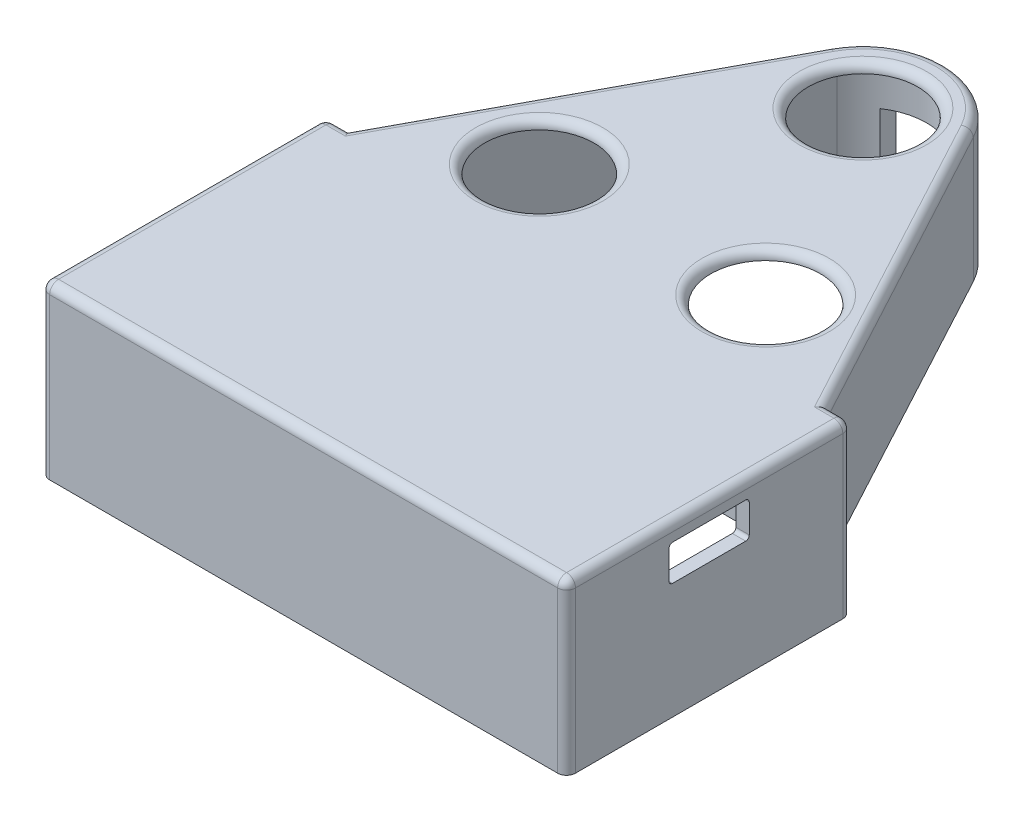
from build123d import *

# Parameters (mm, degrees)
SKETCH1_R           = 6.14
BOSS_EXTRUDE1_DEPTH = 1
BOSS_EXTRUDE2_START = -18
SKETCH1_7_R         = 6.14
SKETCH1_7_W         = 59
SKETCH1_7_H         = 32
SKETCH1_7_W_2       = 56
SKETCH1_7_H_2       = 29
BOSS_EXTRUDE2_DEPTH = 18
BOSS_EXTRUDE4_DEPTH = 14
FILLET1_R           = 1
CUT_EXTRUDE2_DEPTH  = 14
CUT_EXTRUDE3_DEPTH  = 14
FILLET2_R           = 1
SKETCH24_W          = 56
SKETCH24_H          = 1.5
CUT_EXTRUDE5_DEPTH  = 4
BOSS_EXTRUDE5_REACH = 54.785
SKETCH26_W          = 2
SKETCH26_H          = 1.85
BOSS_EXTRUDE6_REACH = 72.258
SKETCH27_W          = 2
SKETCH27_H          = 1.85
SKETCH29_W          = 8
SKETCH29_H          = 5
CUT_EXTRUDE7_DEPTH  = 10
CHAMFER1_SIZE       = 0.5
CHAMFER2_SIZE       = 0.25


# Some blends are built 0.0001 mm under size
with BuildPart() as part:
    # Sketch1 → Boss-Extrude1 (new body)
    with BuildSketch(Plane(origin=(0, 0, 0), x_dir=(1, 0, 0), z_dir=(0, 1, 0))):
        with BuildLine():
            Line((26.916456077, -7.14), (8.050130866, 27.948393818))
            ThreePointArc((8.050130866, 27.948393818), (0, 32.76), (-8.050130866, 27.948393818))
            Line((-8.050130866, 27.948393818), (-26.916456077, -7.14))
            Line((-26.916456077, -7.14), (-29.5, -7.14))
            Line((-29.5, -7.14), (-29.5, -39.14))
            Line((-29.5, -39.14), (29.5, -39.14))
            Line((29.5, -39.14), (29.5, -7.14))
            Line((29.5, -7.14), (26.916456077, -7.14))
        make_face()
        with Locations(Location((-12.7, 0, 0), (0, 0, 270))):
            Circle(SKETCH1_R, mode=Mode.SUBTRACT)
        with Locations(Location((0, 23.62, 0), (0, 0, 270))):
            Circle(SKETCH1_R, mode=Mode.SUBTRACT)
        with Locations(Location((12.7, 0, 0), (0, 0, 270))):
            Circle(SKETCH1_R, mode=Mode.SUBTRACT)
    extrude(amount=BOSS_EXTRUDE1_DEPTH)

    # Sketch1<7> → Boss-Extrude2 (add)
    # profile 1 of 4: a face of its own
    with BuildSketch(Plane(origin=(0, 0, 0), x_dir=(1, 0, 0), z_dir=(0, 1, 0)).offset(BOSS_EXTRUDE2_START)):
        with Locations(Location((-12.7, 0, 0), (0, 0, 270))):
            Circle(SKETCH1_7_R)
    # profile 2 of 4: a face of its own
    with BuildSketch(Plane(origin=(0, 0, 0), x_dir=(1, 0, 0), z_dir=(0, 1, 0)).offset(BOSS_EXTRUDE2_START)):
        with Locations(Location((0, 23.62, 0), (0, 0, 270))):
            Circle(SKETCH1_7_R)
    # profile 3 of 4: a face of its own
    with BuildSketch(Plane(origin=(0, 0, 0), x_dir=(1, 0, 0), z_dir=(0, 1, 0)).offset(BOSS_EXTRUDE2_START)):
        with Locations(Location((12.7, 0, 0), (0, 0, 270))):
            Circle(SKETCH1_7_R)
    # profile 4 of 4: a face of its own
    with BuildSketch(Plane(origin=(0, 0, 0), x_dir=(1, 0, 0), z_dir=(0, 1, 0)).offset(BOSS_EXTRUDE2_START)):
        with Locations((0, -23.14)):
            Rectangle(SKETCH1_7_W, SKETCH1_7_H)
        with Locations((0, -23.14)):
            Rectangle(SKETCH1_7_W_2, SKETCH1_7_H_2, mode=Mode.SUBTRACT)
    extrude(amount=BOSS_EXTRUDE2_DEPTH)


with BuildPart() as boss_extrude2_kept_piece:
    # of the separate pieces the step leaves, the one the design keeps (boss_extrude2_pieces_kept)
    add(part.part.solids().sort_by_distance((26.916456077, 0, 7.14))[0])

    # Sketch16 → Boss-Extrude4 (add)
    with BuildSketch(Plane.XZ):
        with BuildLine():
            Line((-24.645685539, 7.14), (-6.288614265, -27.001261692))
            ThreePointArc((-6.288614265, -27.001261692), (0, -30.76), (6.288614265, -27.001261692))
            Line((6.288614265, -27.001261692), (24.645685539, 7.14))
            Line((24.645685539, 7.14), (26.916456077, 7.14))
            Line((26.916456077, 7.14), (8.050130866, -27.948393818))
            ThreePointArc((8.050130866, -27.948393818), (0, -32.76), (-8.050130866, -27.948393818))
            Line((-8.050130866, -27.948393818), (-26.916456077, 7.14))
            Line((-26.916456077, 7.14), (-24.645685539, 7.14))
        make_face()
    extrude(amount=BOSS_EXTRUDE4_DEPTH)

    # Fillet1
    fillet1_edges = [boss_extrude2_kept_piece.edges().sort_by_distance(p)[0] for p in [
        (-29.5, -8.5, 7.14),
        (29.5, -8.5, 7.14),
        (29.5, -8.5, 39.14),
        (-29.5, -8.5, 39.14),
    ]]
    fillet(fillet1_edges, radius=FILLET1_R)

    # Sketch19 → Cut-Extrude2 (cut)
    with BuildSketch(Plane(origin=(29.5, 0, 0), x_dir=(0, 0, -1), z_dir=(1, 0, 0))):
        with BuildLine():
            Line((-27.24, -1), (-19.04, -1))
            ThreePointArc((-19.04, -1), (-18.757157288, -1.117157288), (-18.64, -1.4))
            Line((-18.64, -1.4), (-18.64, -4.6))
            ThreePointArc((-18.64, -4.6), (-18.757157288, -4.882842712), (-19.04, -5))
            Line((-19.04, -5), (-27.24, -5))
            ThreePointArc((-27.24, -5), (-27.522842712, -4.882842712), (-27.64, -4.6))
            Line((-27.64, -4.6), (-27.64, -1.4))
            ThreePointArc((-27.64, -1.4), (-27.522842712, -1.117157288), (-27.24, -1))
        make_face()
    extrude(amount=-CUT_EXTRUDE2_DEPTH, mode=Mode.SUBTRACT)

    # Sketch21 → Cut-Extrude3 (cut)
    with BuildSketch(Plane.XY.offset(8.64)):
        Polygon((8, 0), (-8, 0), (-8, -5.911265283), (-8, -14), (8, -14), (8, -5.911265283), align=None)
    extrude(amount=-CUT_EXTRUDE3_DEPTH, mode=Mode.SUBTRACT)

    # Fillet2
    fillet2_edges = [boss_extrude2_kept_piece.edges().sort_by_distance(p)[0] for p in [
        (0, 1, 39.14),
        (-29.5, 1, 23.14),
        (29.5, 1, 23.14),
        (-27.708228038, 1, 7.14),
        (29.207106781, 1, 7.432893219),
        (29.207106781, 1, 38.847106781),
        (-29.207106781, 1, 7.432893219),
        (-29.207106781, 1, 38.847106781),
        (27.708228038, 1, 7.14),
        (17.483293471, 1, -10.404196909),
        (0, 1, -32.76),
        (-17.483293471, 1, -10.404196909),
        (-12.7, 1, -6.14),
        (0, 1, -29.76),
        (12.7, 1, -6.14),
    ]]
    fillet(fillet2_edges, radius=FILLET2_R - 0.0001)  # a hair under: the kernel refuses the full size

    # Sketch24 → Cut-Extrude5 (cut)
    with BuildSketch(Plane(origin=(0, -18, 0), x_dir=(-1, 0, 0), z_dir=(0, -1, 0))):
        with Locations((0, -7.89)):
            Rectangle(SKETCH24_W, SKETCH24_H)
    extrude(amount=-CUT_EXTRUDE5_DEPTH, mode=Mode.SUBTRACT)

    # Sketch26 → Boss-Extrude5 (add, up to next)
    with BuildSketch(Plane(origin=(0, 0, 7.14), x_dir=(-1, 0, 0), z_dir=(0, 0, -1)), mode=Mode.PRIVATE) as boss_extrude5_sk1:
        with Locations((27, -17.075)):
            Rectangle(SKETCH26_W, SKETCH26_H)
    boss_extrude5_tool1 = extrude(boss_extrude5_sk1.sketch, amount=-BOSS_EXTRUDE5_REACH, mode=Mode.PRIVATE) - boss_extrude2_kept_piece.part
    # Sketch26 → Boss-Extrude5 (add, up to next)
    with BuildSketch(Plane(origin=(0, 0, 7.14), x_dir=(-1, 0, 0), z_dir=(0, 0, -1)), mode=Mode.PRIVATE) as boss_extrude5_sk2:
        with Locations((-27, -17.075)):
            Rectangle(SKETCH26_W, SKETCH26_H)
    boss_extrude5_tool2 = extrude(boss_extrude5_sk2.sketch, amount=-BOSS_EXTRUDE5_REACH, mode=Mode.PRIVATE) - boss_extrude2_kept_piece.part
    add(boss_extrude5_tool1.solids().sort_by_distance((-27, -17.075, 7.14))[0])
    add(boss_extrude5_tool2.solids().sort_by_distance((27, -17.075, 7.14))[0])

    # Sketch27 → Boss-Extrude6 (add, up to next)
    with BuildSketch(Plane.ZY.offset(-26), mode=Mode.PRIVATE) as boss_extrude6_sk1:
        with Locations((36.64, -17.075)):
            Rectangle(SKETCH27_W, SKETCH27_H)
    boss_extrude6_tool1 = extrude(boss_extrude6_sk1.sketch, amount=BOSS_EXTRUDE6_REACH, mode=Mode.PRIVATE) - boss_extrude2_kept_piece.part
    add(boss_extrude6_tool1.solids().sort_by_distance((26, -17.075, 36.64))[0])

    # Sketch29 → Cut-Extrude7 (cut)
    with BuildSketch(Plane.XZ.offset(14)):
        with Locations((0, -32.034355417)):
            Rectangle(SKETCH29_W, SKETCH29_H)
    extrude(amount=-CUT_EXTRUDE7_DEPTH, mode=Mode.SUBTRACT)

    # Chamfer1
    # the kernel refuses this chamfer: 0.5, 0.374030712 mm, written as the material it takes off along each edge
    with BuildSketch(Plane(origin=(-4, -4, -31.838247988), x_dir=(-0.89007215049111, 0, 0.4558196649116082), z_dir=(0, -1, 0))) as chamfer1_piece_1:
        with BuildLine():
            Line((0.371500885, 0), (CHAMFER1_SIZE * 0.455819664912, -CHAMFER1_SIZE * 0.890072150491))
            Line((CHAMFER1_SIZE * 0.455819664912, -CHAMFER1_SIZE * 0.890072150491), (0, 0))
            ThreePointArc((0, 0), (0.18881851, 0.001887165), (0.371500885, 0))
        make_face()
    extrude(amount=11.285841494, mode=Mode.SUBTRACT)
    with BuildSketch(Plane(origin=(4, -4, -31.838247988), x_dir=(0.8900721504911105, 0, 0.4558196649116072), z_dir=(0, -1, 0))) as chamfer1_piece_2:
        with BuildLine():
            Line((0.371500885, 0), (CHAMFER1_SIZE * 0.455819664912, CHAMFER1_SIZE * 0.890072150491))
            Line((CHAMFER1_SIZE * 0.455819664912, CHAMFER1_SIZE * 0.890072150491), (0, 0))
            ThreePointArc((0, 0), (0.18881851, -0.001887165), (0.371500885, 0))
        make_face()
    extrude(amount=11.285841494, mode=Mode.SUBTRACT)

    # Chamfer2
    chamfer2_edges = [boss_extrude2_kept_piece.edges().sort_by_distance(p)[0] for p in [
        (28, -15.075, 7.14),
        (-28, -15.075, 7.14),
        (-27, -16.15, 7.14),
        (27, -16.15, 7.14),
    ]]
    chamfer(chamfer2_edges, length=CHAMFER2_SIZE)


solid = boss_extrude2_kept_piece.part
